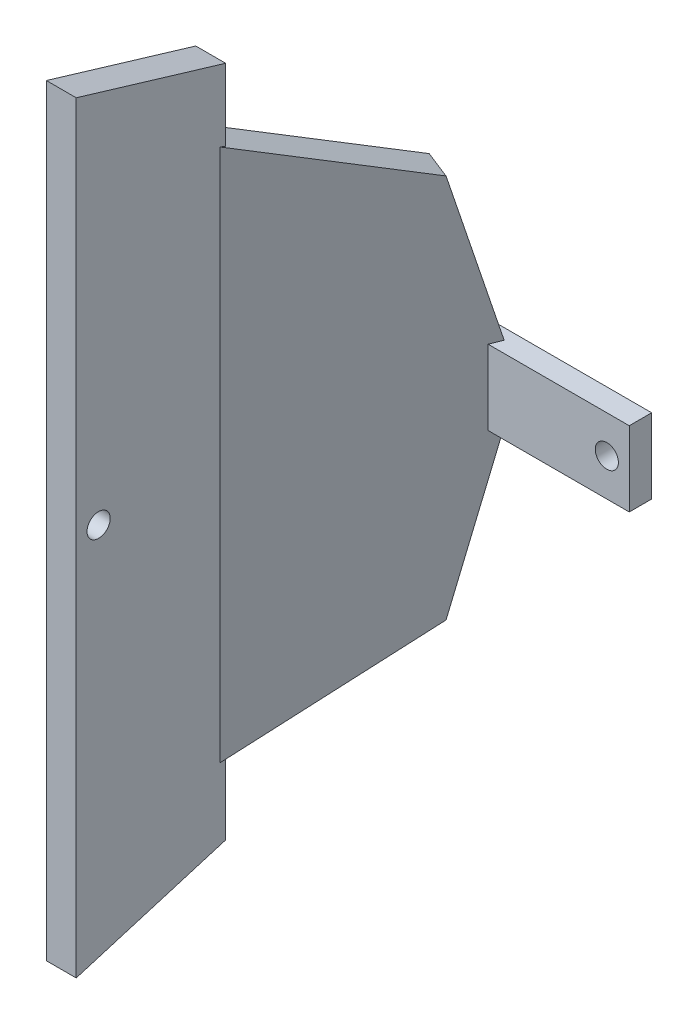
from build123d import *

# Parameters (mm, degrees)
EXTRUDE_1_DEPTH     = 10
SKETCH_2_R          = 1.55
CUT_EXTRUDE_3_DEPTH = 10
CUT_EXTRUDE_4_DEPTH = 10
EXTRUDE_2_DEPTH     = 4
SKETCH_5_R          = 1.55
EXTRUDE_4_DEPTH     = 4


with BuildPart() as part:
    # 草图1 → 凸台-拉伸1 (new body)
    with BuildSketch(Plane(origin=(0, 0, 0), x_dir=(1, 0, 0), z_dir=(0, 1, 0))):
        Polygon((0, 0), (3, 0), (3, 16.697011668), (14.11903113, 45), (33, 45), (33, 48), (11, 48), (0, 20), align=None)
    extrude(amount=EXTRUDE_1_DEPTH)

    # 草图2 → 切除-拉伸3 (cut)
    with BuildSketch(Plane.ZY):
        with Locations((-3, 5)):
            Circle(SKETCH_2_R)
    extrude(amount=-CUT_EXTRUDE_3_DEPTH, mode=Mode.SUBTRACT)

    # 草图3 → 切除-拉伸4 (cut)
    with BuildSketch(Plane(origin=(0, 0, -48), x_dir=(-1, 0, 0), z_dir=(0, 0, -1))):
        with BuildLine():
            ThreePointArc((-31.55, 5), (-30, 3.45), (-28.45, 5))
            ThreePointArc((-28.45, 5), (-30, 6.55), (-31.55, 5))
        make_face()
    extrude(amount=-CUT_EXTRUDE_4_DEPTH, mode=Mode.SUBTRACT)

    # 草图4 → 凸台-拉伸2 (add)
    with BuildSketch(Plane(origin=(-6.806629834, 0, -2.674033149), x_dir=(-0.36565237242299337, 0, 0.9307514934403471), z_dir=(-0.9307514934403471, 0, -0.36565237242299337))):
        Polygon((-18.615029869, 10), (-18.615029869, 41), (-42.698247782, 30.73), (-48.698247782, 10), (-48.698247782, 0), (-42.698247782, -20.73), (-18.615029869, -31), align=None)
    extrude(amount=-EXTRUDE_2_DEPTH)

    # 草图5 → 凸台-拉伸4 (add)
    with BuildSketch(Plane.ZY):
        Polygon((-20, 41), (-20, -31), (-20, -40), (0, -46), (0, 56), (-20, 50), align=None)
        with Locations((-3, 5)):
            Circle(SKETCH_5_R, mode=Mode.SUBTRACT)
    extrude(amount=-EXTRUDE_4_DEPTH)


solid = part.part
